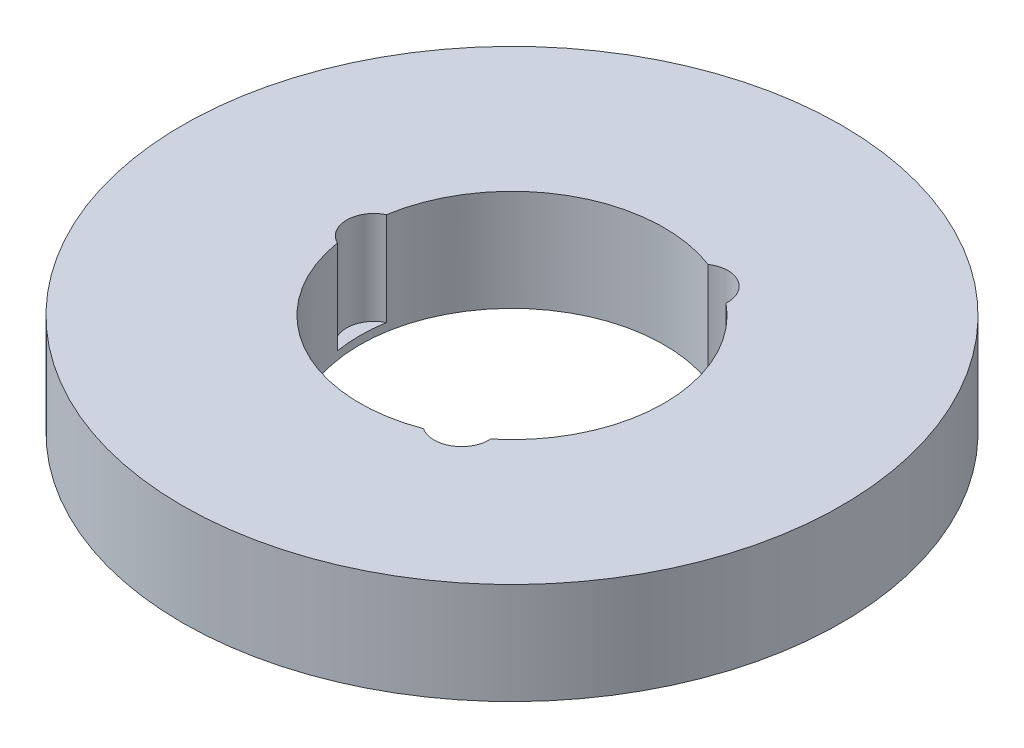
from build123d import *

# Parameters (mm, degrees)
SKETCH1_R           = 97.5
BOSS_EXTRUDE1_DEPTH = 30
SKETCH2_R           = 45
CUT_EXTRUDE1_DEPTH  = 142.111657917
SKETCH3_R           = 8.105013215
CUT_EXTRUDE2_DEPTH  = 27.650849265
CIRPATTERN1_COUNT   = 3


with BuildPart() as part:
    # Sketch1 → Boss-Extrude1 (new body)
    with BuildSketch(Plane(origin=(0, 0, 0), x_dir=(1, 0, 0), z_dir=(0, 1, 0))):
        Circle(SKETCH1_R)
    extrude(amount=BOSS_EXTRUDE1_DEPTH)

    # Sketch2 → Cut-Extrude1 (cut, through all)
    with BuildSketch(Plane(origin=(0, 0, 0), x_dir=(1, 0, 0), z_dir=(0, 1, 0))):
        Circle(SKETCH2_R)
    extrude(amount=CUT_EXTRUDE1_DEPTH, mode=Mode.SUBTRACT)

    # Sketch3 → Cut-Extrude2 (cut)
    with BuildSketch(Plane(origin=(0, 30, 0), x_dir=(1, 0, 0), z_dir=(0, 1, 0))):
        with Locations((-40.814870725, 0)):
            Circle(SKETCH3_R)
    cut_extrude2 = extrude(amount=-CUT_EXTRUDE2_DEPTH, mode=Mode.SUBTRACT)

    # CirPattern1: Cut-Extrude2 ×3 about axis
    cirpattern1_axis = Axis((0, 0, 0), (0, 1, 0))
    for i in range(1, CIRPATTERN1_COUNT):
        add(cut_extrude2.rotate(cirpattern1_axis, i * 360 / CIRPATTERN1_COUNT), mode=Mode.SUBTRACT)


solid = part.part
